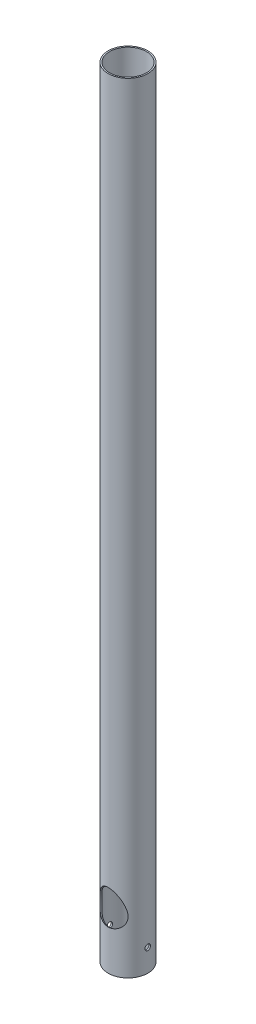
from build123d import *

# Parameters (mm, degrees)
EXTRUDE_1_OUTLINE_R      = 70.5
EXTRUDE_1_OUTLINE_R_2    = 65.5
EXTRUDE_1_DEPTH          = 2770
CUT_EXTRUDE_3_DEPTH      = 2772.793733307
CUT_EXTRUDE_3_DEPTH_BACK = 2772.793733307
SKETCH_6_R               = 10
SKETCH_7_R               = 50
CUT_EXTRUDE_4_DEPTH      = 200
SKETCH_13_R              = 52.5
CUT_EXTRUDE_8_DEPTH      = 200


# Read off the part's stored shape, not the designer's step: Вытянуть-Тонкостенный1
with BuildPart() as part:
    # Вытянуть-Тонкостенный1 outline → Вытянуть-Тонкостенный1 (new body)
    with BuildSketch(Plane(origin=(0, 0, 0), x_dir=(1, 0, 0), z_dir=(0, 1, 0))):
        Circle(EXTRUDE_1_OUTLINE_R)
        Circle(EXTRUDE_1_OUTLINE_R_2, mode=Mode.SUBTRACT)
    extrude(amount=EXTRUDE_1_DEPTH)

    # Эскиз6 → Вырез-Вытянуть3 (cut, two sides: drawn at the far end of the back side and taken through both)
    with BuildSketch(Plane(origin=(0, 0, 0), x_dir=(0, 0, -1), z_dir=(1, 0, 0)).offset(-CUT_EXTRUDE_3_DEPTH_BACK)):
        with Locations((0, 80)):
            Circle(SKETCH_6_R)
    extrude(amount=CUT_EXTRUDE_3_DEPTH + CUT_EXTRUDE_3_DEPTH_BACK, mode=Mode.SUBTRACT)

    # Эскиз7 → Вырез-Вытянуть4 (cut)
    with BuildSketch(Plane(origin=(0, 176.689515805, 252.338779809), x_dir=(1, 0, 0), z_dir=(0, -0.5735764363510416, -0.8191520442889949))):
        with Locations(Location((0, -126.118813858, 0), (0, 0, 90))):
            Circle(SKETCH_7_R)
    extrude(amount=CUT_EXTRUDE_4_DEPTH, mode=Mode.SUBTRACT)

    # Эскиз13 → Вырез-Вытянуть8 (cut)
    with BuildSketch(Plane(origin=(0, 750.265952156, 1071.490824098), x_dir=(1, 0, 0), z_dir=(0, -0.5735764363510416, -0.8191520442889949))):
        with Locations(Location((0, -2185, 0), (0, 0, 270))):
            Circle(SKETCH_13_R)
    extrude(amount=-CUT_EXTRUDE_8_DEPTH, mode=Mode.SUBTRACT)


solid = part.part
